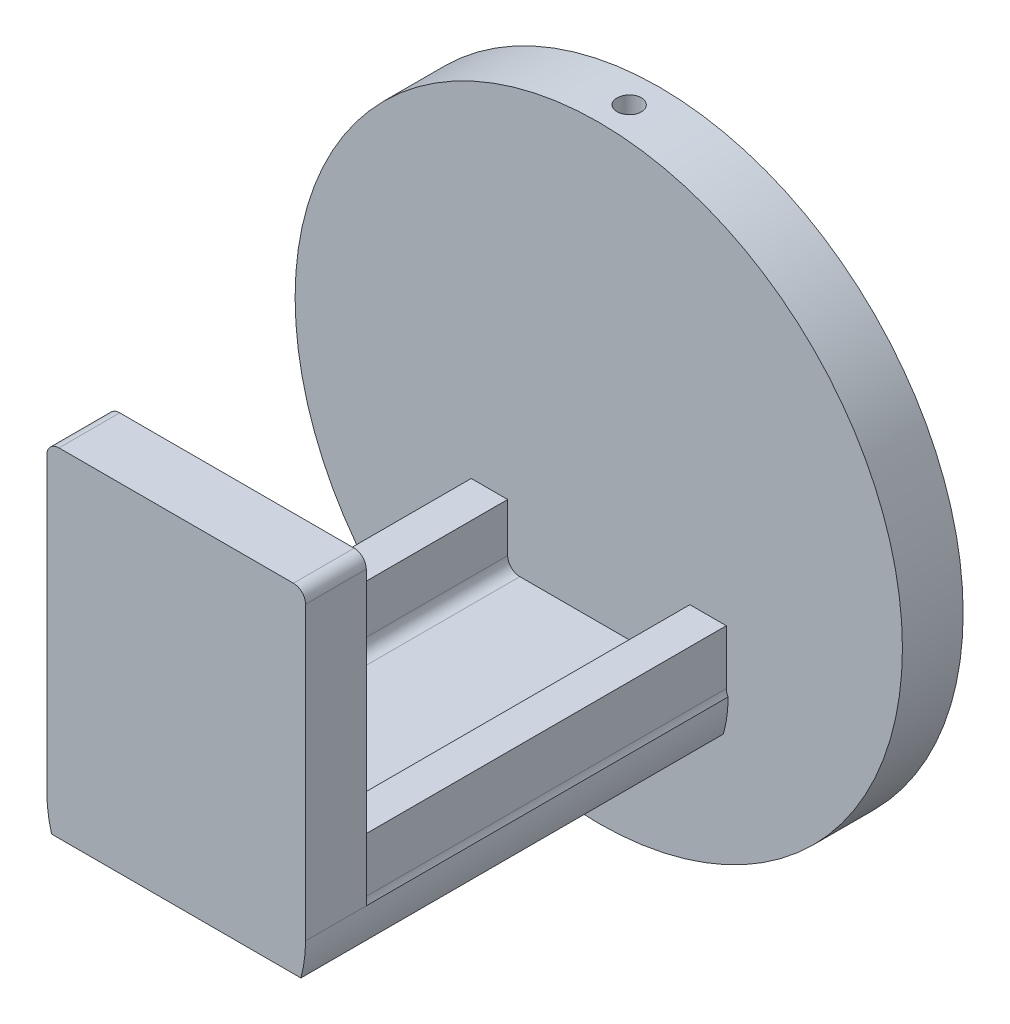
from build123d import *

# Parameters (mm, degrees)
SKETCH1_R               = 25
BOSS_EXTRUDE1_DEPTH     = 5
BOSS_EXTRUDE2_DEPTH     = 34.79
SKETCH3_W               = 21.3
SKETCH3_H               = 5
BOSS_EXTRUDE3_DEPTH     = 25
SKETCH4_W               = 3
SKETCH4_H               = 29.79
BOSS_EXTRUDE5_DEPTH     = 5
CUT_EXTRUDE1_DEPTH      = 38
CUT_EXTRUDE1_DEPTH_BACK = 50.601855812
SKETCH5_R               = 1
FILLET1_R               = 1
FILLET2_R               = 1
FILLET3_R               = 1
CUT_EXTRUDE2_REACH      = 55.228
CUT_EXTRUDE2_END_RADIUS = 1
SKETCH6_R               = 0.5


with BuildPart() as part:
    # Sketch1 → Boss-Extrude1 (new body)
    with BuildSketch(Plane.XY):
        Circle(SKETCH1_R)
    extrude(amount=-BOSS_EXTRUDE1_DEPTH)

    # Sketch2 → Boss-Extrude2 (add)
    with BuildSketch(Plane.XY):
        with BuildLine():
            Line((-10.65, -10.65), (10.65, -10.65))
            ThreePointArc((10.65, -10.65), (10.553147336, -12.083032205), (10.264350929, -13.49))
            Line((10.264350929, -13.49), (-10.264350929, -13.49))
            ThreePointArc((-10.264350929, -13.49), (-10.553147336, -12.083032205), (-10.65, -10.65))
        make_face()
    extrude(amount=BOSS_EXTRUDE2_DEPTH)

    # Sketch3 → Boss-Extrude3 (add)
    with BuildSketch(Plane(origin=(0, -10.65, 0), x_dir=(1, 0, 0), z_dir=(0, 1, 0))):
        with Locations((0, -32.29)):
            Rectangle(SKETCH3_W, SKETCH3_H)
    extrude(amount=BOSS_EXTRUDE3_DEPTH)

    # Sketch4 → Boss-Extrude5 (add)
    with BuildSketch(Plane(origin=(0, -10.65, 0), x_dir=(1, 0, 0), z_dir=(0, 1, 0))):
        with Locations((9, -14.895)):
            Rectangle(SKETCH4_W, SKETCH4_H)
        with Locations((-9, -14.895)):
            Rectangle(SKETCH4_W, SKETCH4_H)
    extrude(amount=BOSS_EXTRUDE5_DEPTH)

    # Sketch5 → Cut-Extrude1 (cut, two sides: drawn at the far end of the back side and taken through both)
    with BuildSketch(Plane(origin=(0, 0, 0), x_dir=(1, 0, 0), z_dir=(0, 1, 0)).offset(-CUT_EXTRUDE1_DEPTH_BACK)):
        with Locations(Location((0, 2.5, 0), (0, 0, 90))):
            Circle(SKETCH5_R)
    extrude(amount=CUT_EXTRUDE1_DEPTH + CUT_EXTRUDE1_DEPTH_BACK, mode=Mode.SUBTRACT)

    # Fillet1
    fillet1_edges = [part.edges().sort_by_distance(p)[0] for p in [
        (10.65, 14.35, 32.29),
        (-10.65, 14.35, 32.29),
    ]]
    fillet(fillet1_edges, radius=FILLET1_R)

    # Fillet2
    fillet2_edges = [part.edges().sort_by_distance(p)[0] for p in [
        (7.5, -10.65, 14.895),
        (-7.5, -10.65, 14.895),
    ]]
    fillet(fillet2_edges, radius=FILLET2_R)

    # Fillet3
    # the kernel refuses this fillet: 1 mm, written as the material it adds along each edge
    with BuildSketch(Plane(origin=(10.5, -10.65, 31.106956719), x_dir=(0, 1, 0), z_dir=(0, 0, -1))) as fillet3_piece_1:
        with BuildLine():
            CenterArc((0.526782688, 1), FILLET3_R, 238.211669382, 31.788330618)
            Line((0, 0.15), (-0.010535654, 0.133))
            ThreePointArc((-0.010535654, 0.133), (-0.02, 0.075), (-0.02, 0))
            Line((-0.02, 0), (0, -0.02))
            Line((0, -0.02), (0.526782688, -0.02))
            Line((0.526782688, -0.02), (0.526782688, 0))
        make_face()
    extrude(amount=32.423913438)
    with BuildSketch(Plane(origin=(-10.5, -10.65, 31.106956719), x_dir=(0, 1, 0), z_dir=(0, 0, -1))) as fillet3_piece_2:
        with BuildLine():
            CenterArc((0.526782688, -1), FILLET3_R, 90, 31.788330618)
            Line((0, -0.15), (-0.010535654, -0.133))
            ThreePointArc((-0.010535654, -0.133), (-0.02, -0.075), (-0.02, 0))
            Line((-0.02, 0), (0, 0.02))
            Line((0, 0.02), (0.526782688, 0.02))
            Line((0.526782688, 0.02), (0.526782688, 0))
        make_face()
    extrude(amount=32.423913438)

    # Cut-Extrude2: up to this cylinder (the profile starts outside it)
    cut_extrude2_end = Plane(origin=(0, 0, -2.5), z_dir=(0, -1, 0)) * Cylinder(CUT_EXTRUDE2_END_RADIUS, 135.456, mode=Mode.PRIVATE)
    # Sketch6 → Cut-Extrude2 (cut, up to the surface)
    with BuildSketch(Plane(origin=(0, 0, -5), x_dir=(-1, 0, 0), z_dir=(0, 0, -1)), mode=Mode.PRIVATE) as cut_extrude2_sk1:
        with Locations((0, 11)):
            Circle(SKETCH6_R)
    cut_extrude2_tool1 = extrude(cut_extrude2_sk1.sketch, amount=-CUT_EXTRUDE2_REACH, mode=Mode.PRIVATE) - cut_extrude2_end
    add(cut_extrude2_tool1.solids().sort_by_distance((0, 11, -5))[0], mode=Mode.SUBTRACT)
    # Sketch6 → Cut-Extrude2 (cut, up to the surface)
    with BuildSketch(Plane(origin=(0, 0, -5), x_dir=(-1, 0, 0), z_dir=(0, 0, -1)), mode=Mode.PRIVATE) as cut_extrude2_sk2:
        with Locations((0, -11)):
            Circle(SKETCH6_R)
    cut_extrude2_tool2 = extrude(cut_extrude2_sk2.sketch, amount=-CUT_EXTRUDE2_REACH, mode=Mode.PRIVATE) - cut_extrude2_end
    add(cut_extrude2_tool2.solids().sort_by_distance((0, -11, -5))[0], mode=Mode.SUBTRACT)


solid = part.part
